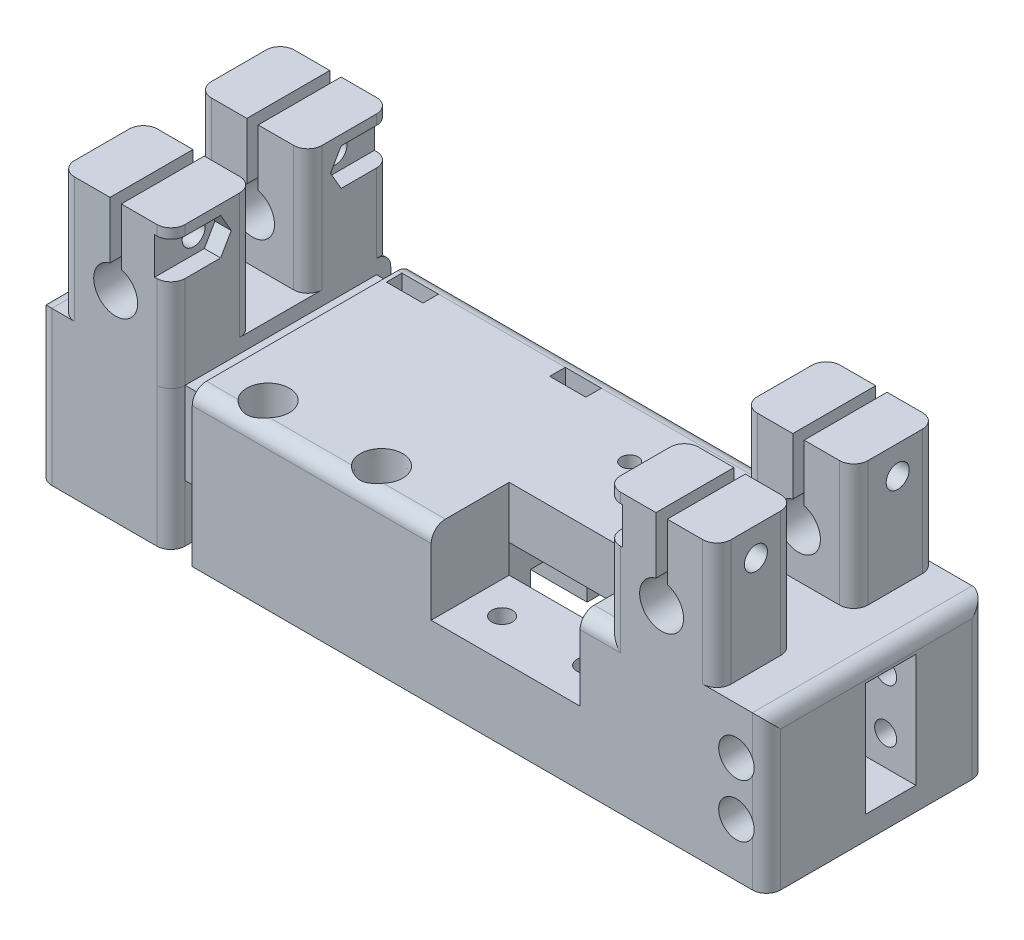
from build123d import *
from OCP.BRepFilletAPI import BRepFilletAPI_MakeChamfer

# Parameters (mm, degrees)
SKETCH1_R                      = 3.0999999999999877
SKETCH1_R_2                    = 3.099999999999995
SKETCH1_R_3                    = 3.4999999999999822
BOSS_EXTRUDE1_DEPTH            = 31
BOSS_EXTRUDE2_DEPTH            = 8
SKETCH3_R                      = 1.2000000000000004
SKETCH3_R_2                    = 1.2000000000000113
CUT_EXTRUDE1_DEPTH             = 71.57779906528764
CUT_EXTRUDE4_START             = -1.9
CUT_EXTRUDE4_DEPTH             = 1.9
CUT_EXTRUDE5_DEPTH             = 14
CUT_EXTRUDE6_REACH             = 106.86
SKETCH8_W                      = 3
SKETCH8_H                      = 17.650000000001818
CUT_EXTRUDE7_REACH             = 106.86
SKETCH9_W                      = 2.3000000000000043
SKETCH9_H                      = 17.64999999999997
CUT_EXTRUDE8_REACH             = 100.506
SKETCH10_R                     = 1.6249999999999998
CUT_EXTRUDE8_DIRECTION_2_REACH = 100.506
CUT_EXTRUDE9_REACH             = 99.066
SKETCH11_R                     = 1.6250000000000013
CUT_EXTRUDE9_DIRECTION_2_REACH = 99.066
CUT_EXTRUDE10_DEPTH            = 2.3
CUT_EXTRUDE11_DEPTH            = 2.3
HOLE2_D                        = 5.6
HOLE2_DEPTH                    = 12
HOLE2_CBORE_D                  = 6
HOLE2_CBORE_DEPTH              = 8
CUT_EXTRUDE14_DEPTH            = 20
SKETCH24_R                     = 1.2000000000000004
CUT_EXTRUDE15_DEPTH            = 10
HOLE1_D                        = 5.6
HOLE1_DEPTH                    = 12
HOLE1_CBORE_D                  = 6
HOLE1_CBORE_DEPTH              = 8
CUT_EXTRUDE17_REACH            = 76.028
CUT_EXTRUDE19_REACH            = 81.375
SKETCH32_W                     = 99.00000000000004
SKETCH32_H                     = 7.999999999998149
CUT_EXTRUDE20_DEPTH            = 75.02825455816884
CHAMFER1_SIZE                  = 8
CHAMFER1_SIZE_2                = 0.2
CHAMFER2_SIZE                  = 8
CHAMFER2_SIZE_2                = 0.2
SKETCH35_W                     = 25.700000000000017
SKETCH35_H                     = 11.699999999999998
CUT_EXTRUDE22_DEPTH            = 17.65
BOSS_EXTRUDE5_DEPTH            = 11
SKETCH49_R                     = 1.675000000000001
CUT_EXTRUDE28_DEPTH            = 5
SKETCH50_W                     = 21
SKETCH50_H                     = 8
CUT_EXTRUDE29_DEPTH            = 8.65
FILLET2_R                      = 2
FILLET1_R                      = 2
M2_5_CLEARANCE_HOLE1_D         = 2.9
CUT_EXTRUDE30_DEPTH            = 8
CUT_EXTRUDE31_DEPTH            = 2
SKETCH57_W                     = 2.999999999999993
SKETCH57_H                     = 11.650000000000034
CUT_EXTRUDE32_DEPTH            = 2
SKETCH58_W                     = 3.0000000000000036
SKETCH58_H                     = 11.650000000000034
CUT_EXTRUDE33_DEPTH            = 2
CUT_EXTRUDE35_DEPTH            = 11
SKETCH61_R                     = 2.7499999999999982
CUT_EXTRUDE36_DEPTH            = 4
FILLET3_START                  = -19
FILLET3_DEPTH                  = 33.672858748
FILLET3_START_2                = 32
FILLET3_2_DEPTH                = 6.896819666
FILLET3_START_3                = 1
FILLET3_3_DEPTH                = 2.625360835
CUT_EXTRUDE37_DEPTH            = 2.2
M2_5_CLEARANCE_HOLE2_D         = 2.9
M2_5_CLEARANCE_HOLE2_DEPTH     = 11
M2_5_CLEARANCE_HOLE2_TIP       = 0.8712478975899624
SKETCH67_R                     = 1.45
SKETCH67_R_2                   = 1.4499999999999895
SKETCH67_R_3                   = 1.449999999999989
CUT_EXTRUDE38_DEPTH            = 11
SKETCH71_W                     = 31.000000000000004
SKETCH71_H                     = 21.650000000000023
BOSS_EXTRUDE6_DEPTH            = 3.8
CUT_EXTRUDE41_START            = 102.8
CUT_EXTRUDE41_DEPTH            = 8.1
M2_5_CLEARANCE_HOLE3_D         = 3.1
SKETCH83_R                     = 2.500000000000002
SKETCH83_R_2                   = 2.5000000000000018
CUT_EXTRUDE42_DEPTH            = 10
CUT_EXTRUDE43_START            = -3
SKETCH84_R                     = 1.2000000000000004
SKETCH84_W                     = 4.249999999999993
SKETCH84_H                     = 2.000000000000007
SKETCH84_W_2                   = 4.2499999999999964
CUT_EXTRUDE43_DEPTH            = 2
FILLET5_R                      = 2


with BuildPart() as part:
    # Sketch1 → Boss-Extrude1 (new body)
    with BuildSketch(Plane.XY):
        Polygon((-43.303180334061175, 29.275360835161887), (25.696819665938843, 29.275360835161887), (55.69681966593887, 29.275360835161887), (55.696819665938875, -18.024639164838103), (-43.303180334061175, -18.024639164838117), align=None)
        with Locations((-32.30318033406116, 10.275360835161894)):
            Circle(SKETCH1_R, mode=Mode.SUBTRACT)
        with Locations((44.69681966593886, 10.275360835161894)):
            Circle(SKETCH1_R_2, mode=Mode.SUBTRACT)
        with Locations((22.696819665938847, 12.275360835161898)):
            Circle(SKETCH1_R_3, mode=Mode.SUBTRACT)
        Polygon((-22.803180334061157, 19.27536083516189), (-22.803180334061153, 3.6253608351619206), (9.196819665938847, 3.6253608351619206), (9.196819665938847, 19.27536083516189), align=None, mode=Mode.SUBTRACT)
    extrude(amount=-BOSS_EXTRUDE1_DEPTH)

    # Sketch2 → Boss-Extrude2 (add)
    with BuildSketch(Plane.XY):
        with BuildLine():
            Line((24.196819665938847, 12.275360835161898), (33.19681966593885, 12.275360835161898))
            Line((33.19681966593885, 12.275360835161898), (33.19681966593885, 3.6253608351619206))
            Line((33.19681966593885, 3.6253608351619206), (12.196819665938845, 3.6253608351619206))
            Line((12.196819665938845, 3.6253608351619206), (12.196819665938845, 12.275360835161896))
            Line((12.196819665938845, 12.275360835161896), (21.196819665938843, 12.275360835161898))
            ThreePointArc((21.196819665938843, 12.275360835161898), (22.696819665938847, 10.775360835161894), (24.196819665938847, 12.275360835161898))
        make_face()
    extrude(amount=BOSS_EXTRUDE2_DEPTH)

    # Sketch3 → Cut-Extrude1 (cut, through all)
    with BuildSketch(Plane(origin=(0, 12.275360835161898, 0), x_dir=(1, 0, 0), z_dir=(0, 1, 0))):
        with Locations(Location((28.696819665938847, -4, 0), (0, 0, 270))):
            Circle(SKETCH3_R)
        with Locations(Location((16.69681966593884, -4.000000000000002, 0), (0, 0, 270))):
            Circle(SKETCH3_R_2)
    extrude(amount=-CUT_EXTRUDE1_DEPTH, mode=Mode.SUBTRACT)

    # Sketch6 → Cut-Extrude4 (cut)
    with BuildSketch(Plane(origin=(-2.37e-15, 12.275360835161894, 0), x_dir=(1, 1.9e-16, 0), z_dir=(-1.9e-16, 1, 0)).offset(CUT_EXTRUDE4_START)):
        Polygon((14.571819665938843, -5.226869322027957), (14.571819665938843, -8), (18.821819665938843, -8), (18.821819665938843, -5.226869322027959), (18.821819665938843, -2.7731306779720506), (16.69681966593884, -1.5462613559440943), (14.571819665938843, -2.773130677972046), align=None)
        Polygon((30.821819665938854, -5.226869322027954), (30.821819665938854, -2.773130677972044), (28.696819665938843, -1.546261355944084), (26.571819665938843, -2.773130677972039), (26.571819665938843, -5.226869322027955), (26.571819665938843, -8), (30.821819665938854, -8), align=None)
    extrude(amount=-CUT_EXTRUDE4_DEPTH, mode=Mode.SUBTRACT)

    # Sketch7 → Cut-Extrude5 (cut)
    with BuildSketch(Plane.XY):
        with BuildLine():
            Line((-43.303180334061175, 22.77536083516189), (-22.503180334061174, 22.77536083516189))
            Line((-22.503180334061174, 22.77536083516189), (-22.503180334061156, 3.6253608351619206))
            Line((-22.503180334061156, 3.6253608351619206), (-24.503180334061156, 3.6253608351619206))
            Line((-24.503180334061156, 3.6253608351619206), (-24.50318033406117, 21.275360835161894))
            Line((-24.50318033406117, 21.275360835161894), (-31.503180334061174, 21.27536083516189))
            Line((-31.503180334061174, 21.27536083516189), (-31.503180334061167, 13.270356661536272))
            ThreePointArc((-31.503180334061167, 13.270356661536272), (-32.30318033406115, 7.175360835161904), (-33.103180334061165, 13.27035666153627))
            Line((-33.103180334061165, 13.27035666153627), (-33.103180334061165, 21.27536083516189))
            Line((-33.103180334061165, 21.27536083516189), (-40.103180334061165, 21.27536083516189))
            Line((-40.103180334061165, 21.27536083516189), (-40.103180334061165, 3.6253608351619198))
            Line((-40.103180334061165, 3.6253608351619198), (-43.303180334061175, 3.6253608351619198))
            Line((-43.303180334061175, 3.6253608351619198), (-43.303180334061175, 22.77536083516189))
        make_face()
        with BuildLine():
            Line((34.896819665938864, 22.775360835163738), (55.696819665938875, 22.775360835163738))
            Line((55.696819665938875, 22.775360835163738), (55.696819665938875, 3.6253608351619215))
            Line((55.696819665938875, 3.6253608351619215), (52.49681966593886, 3.6253608351619206))
            Line((52.49681966593886, 3.6253608351619206), (52.49681966593886, 21.275360835163738))
            Line((52.49681966593886, 21.275360835163738), (45.49681966593886, 21.275360835163738))
            Line((45.49681966593886, 21.275360835163738), (45.496819665938865, 13.27035666153627))
            ThreePointArc((45.496819665938865, 13.27035666153627), (44.69681966593886, 7.1753608351619), (43.89681966593886, 13.270356661536274))
            Line((43.89681966593886, 13.270356661536274), (43.89681966593886, 21.275360835163738))
            Line((43.89681966593886, 21.275360835163738), (36.89681966593886, 21.275360835163738))
            Line((36.89681966593886, 21.275360835163738), (36.89681966593886, 3.6253608351619206))
            Line((36.89681966593886, 3.6253608351619206), (34.89681966593886, 3.6253608351619198))
            Line((34.89681966593886, 3.6253608351619198), (34.896819665938864, 22.775360835163738))
        make_face()
    cut_extrude5 = extrude(amount=-CUT_EXTRUDE5_DEPTH, mode=Mode.SUBTRACT)

    # Sketch8 → Cut-Extrude6 (cut, up to next)
    with BuildSketch(Plane(origin=(52.49681966593886, 0, 0), x_dir=(0, 0, -1), z_dir=(1, 0, 0)), mode=Mode.PRIVATE) as cut_extrude6_sk1:
        with Locations((12.500000000000002, 12.45036083516283)):
            Rectangle(SKETCH8_W, SKETCH8_H)
    cut_extrude6_tool1 = extrude(cut_extrude6_sk1.sketch, amount=-CUT_EXTRUDE6_REACH, mode=Mode.PRIVATE) & part.part
    add(cut_extrude6_tool1.solids().sort_by_distance((52.49682, 12.450361, -12.5))[0], mode=Mode.SUBTRACT)

    # Sketch9 → Cut-Extrude7 (cut, up to next)
    with BuildSketch(Plane.ZY.offset(40.103180334061165), mode=Mode.PRIVATE) as cut_extrude7_sk1:
        with Locations((-12.85, 12.450360835161906)):
            Rectangle(SKETCH9_W, SKETCH9_H)
    cut_extrude7_tool1 = extrude(cut_extrude7_sk1.sketch, amount=-CUT_EXTRUDE7_REACH, mode=Mode.PRIVATE) & part.part
    add(cut_extrude7_tool1.solids().sort_by_distance((-40.10318, 12.450361, -12.85))[0], mode=Mode.SUBTRACT)

    # Sketch10 → Cut-Extrude8 (cut, up to next)
    with BuildSketch(Plane(origin=(-33.103180334061165, 0, 0), x_dir=(0, 0, -1), z_dir=(1, 0, 0)), mode=Mode.PRIVATE) as cut_extrude8_sk1:
        with Locations((5.500000000000001, 17.27285874834908)):
            Circle(SKETCH10_R)
    cut_extrude8_tool1 = extrude(cut_extrude8_sk1.sketch, amount=-CUT_EXTRUDE8_REACH, mode=Mode.PRIVATE) & part.part
    cut_extrude8 = cut_extrude8_tool1.solids().sort_by_distance((-33.10318, 17.272859, -5.5))[0]
    add(cut_extrude8, mode=Mode.SUBTRACT)

    # Sketch10 → Cut-Extrude8 direction 2 (cut, up to next)
    with BuildSketch(Plane(origin=(-33.103180334061165, 0, 0), x_dir=(0, 0, -1), z_dir=(1, 0, 0)), mode=Mode.PRIVATE) as cut_extrude8_direction_2_sk1:
        with Locations((5.500000000000001, 17.27285874834908)):
            Circle(SKETCH10_R)
    cut_extrude8_direction_2_tool1 = extrude(cut_extrude8_direction_2_sk1.sketch, amount=CUT_EXTRUDE8_DIRECTION_2_REACH, mode=Mode.PRIVATE) & part.part
    cut_extrude8_direction_2 = cut_extrude8_direction_2_tool1.solids().sort_by_distance((-33.10318, 17.272859, -5.5))[0]
    add(cut_extrude8_direction_2, mode=Mode.SUBTRACT)

    # Sketch11 → Cut-Extrude9 (cut, up to next)
    with BuildSketch(Plane(origin=(43.89681966593886, 0, 0), x_dir=(0, 0, -1), z_dir=(1, 0, 0)), mode=Mode.PRIVATE) as cut_extrude9_sk1:
        with Locations((5.5, 17.272858748350007)):
            Circle(SKETCH11_R)
    cut_extrude9_tool1 = extrude(cut_extrude9_sk1.sketch, amount=-CUT_EXTRUDE9_REACH, mode=Mode.PRIVATE) & part.part
    cut_extrude9 = cut_extrude9_tool1.solids().sort_by_distance((43.89682, 17.272859, -5.5))[0]
    add(cut_extrude9, mode=Mode.SUBTRACT)

    # Sketch11 → Cut-Extrude9 direction 2 (cut, up to next)
    with BuildSketch(Plane(origin=(43.89681966593886, 0, 0), x_dir=(0, 0, -1), z_dir=(1, 0, 0)), mode=Mode.PRIVATE) as cut_extrude9_direction_2_sk1:
        with Locations((5.5, 17.272858748350007)):
            Circle(SKETCH11_R)
    cut_extrude9_direction_2_tool1 = extrude(cut_extrude9_direction_2_sk1.sketch, amount=CUT_EXTRUDE9_DIRECTION_2_REACH, mode=Mode.PRIVATE) & part.part
    cut_extrude9_direction_2 = cut_extrude9_direction_2_tool1.solids().sort_by_distance((43.89682, 17.272859, -5.5))[0]
    add(cut_extrude9_direction_2, mode=Mode.SUBTRACT)

    # Sketch12 → Cut-Extrude10 (cut)
    with BuildSketch(Plane.ZY.offset(-36.89681966593886)):
        Polygon((-3.998889300106973, 19.872858748349078), (1e-17, 19.872858748349078), (6.5e-16, 14.672858748349078), (-3.9988893001069723, 14.672858748349077), (-7.001110699893019, 14.672858748349075), (-8.502221399786048, 17.27285874834908), (-7.001110699893025, 19.872858748349078), align=None)
    cut_extrude10 = extrude(amount=-CUT_EXTRUDE10_DEPTH, mode=Mode.SUBTRACT)

    # Sketch13 → Cut-Extrude11 (cut)
    with BuildSketch(Plane(origin=(-24.503180334061152, -1.927e-14, 0), x_dir=(0, 0, -1), z_dir=(1, 5e-17, 0))):
        Polygon((3.998889300106974, 19.87285874835002), (0, 19.87285874835002), (-6.5e-16, 14.672858748349094), (3.998889300106973, 14.672858748350016), (7.001110699893027, 14.672858748350018), (8.502221399786055, 17.272858748350018), (7.0011106998930295, 19.87285874835002), align=None)
    cut_extrude11 = extrude(amount=-CUT_EXTRUDE11_DEPTH, mode=Mode.SUBTRACT)

    # Hole2
    with Locations(Plane(origin=(2.53e-15, -18.02463916483811, 0), x_dir=(-1, -1.2e-16, 0), z_dir=(1.2e-16, -1, 0))):
        with Locations((-46.196819666, 10), (33.803180334, 10)):
            CounterBoreHole(HOLE2_D / 2, HOLE2_CBORE_D / 2, HOLE2_CBORE_DEPTH, depth=HOLE2_DEPTH)

    # Sketch23 → Cut-Extrude14 (cut)
    with BuildSketch(Plane(origin=(0, 0, -31), x_dir=(-1, 0, 0), z_dir=(0, 0, -1))):
        Polygon((-34.69681966593882, -18.024639164838117), (-10.696819665938829, -18.024639164838117), (-10.696819665938829, -3.7246391648381154), (-34.696819665938825, -3.7246391648381154), align=None)
    extrude(amount=-CUT_EXTRUDE14_DEPTH, mode=Mode.SUBTRACT)

    # Sketch24 → Cut-Extrude15 (cut)
    with BuildSketch(Plane.XZ.offset(3.7246391648381154)):
        with Locations(Location((18.196819665938833, -22, 0), (0, 0, 270))):
            Circle(SKETCH24_R)
        with Locations(Location((27.696819665938833, -22, 0), (0, 0, 270))):
            Circle(SKETCH24_R)
    extrude(amount=-CUT_EXTRUDE15_DEPTH, mode=Mode.SUBTRACT)

    # Hole1
    with Locations(Plane(origin=(0, 3.6253608351619206, 0), x_dir=(1, 0, 0), z_dir=(0, 1, 0))):
        with Locations((-14.803180334, 4), (1.196819666, 4)):
            CounterBoreHole(HOLE1_D / 2, HOLE1_CBORE_D / 2, HOLE1_CBORE_DEPTH, depth=HOLE1_DEPTH)

    # Sketch30 → Cut-Extrude17 (cut, up to next)
    with BuildSketch(Plane(origin=(0, 0, -31), x_dir=(-1, 0, 0), z_dir=(0, 0, -1)), mode=Mode.PRIVATE) as cut_extrude17_sk1:
        Polygon((-9.196819665938847, 3.6253608351619206), (22.803180334061157, 3.6253608351619198), (22.803180334061153, 29.275360835161887), (-9.196819665938847, 29.275360835161887), align=None)
    cut_extrude17_tool1 = extrude(cut_extrude17_sk1.sketch, amount=-CUT_EXTRUDE17_REACH, mode=Mode.PRIVATE) & part.part
    add(cut_extrude17_tool1.solids().sort_by_distance((-6.80318, 16.450361, -31))[0], mode=Mode.SUBTRACT)

    # Mirror1: Cut-Extrude5, Cut-Extrude8, Cut-Extrude8 direction 2, Cut-Extrude9, Cut-Extrude9 direction 2, Cut-Extrude10, Cut-Extrude11 across plane
    add(cut_extrude5.mirror(Plane(origin=(0, 0, -15.5), x_dir=(1, 0, 0), z_dir=(0, 0, -1))), mode=Mode.SUBTRACT)
    add(cut_extrude8.mirror(Plane(origin=(0, 0, -15.5), x_dir=(1, 0, 0), z_dir=(0, 0, -1))), mode=Mode.SUBTRACT)
    add(cut_extrude8_direction_2.mirror(Plane(origin=(0, 0, -15.5), x_dir=(1, 0, 0), z_dir=(0, 0, -1))), mode=Mode.SUBTRACT)
    add(cut_extrude9.mirror(Plane(origin=(0, 0, -15.5), x_dir=(1, 0, 0), z_dir=(0, 0, -1))), mode=Mode.SUBTRACT)
    add(cut_extrude9_direction_2.mirror(Plane(origin=(0, 0, -15.5), x_dir=(1, 0, 0), z_dir=(0, 0, -1))), mode=Mode.SUBTRACT)
    add(cut_extrude10.mirror(Plane(origin=(0, 0, -15.5), x_dir=(1, 0, 0), z_dir=(0, 0, -1))), mode=Mode.SUBTRACT)
    add(cut_extrude11.mirror(Plane(origin=(0, 0, -15.5), x_dir=(1, 0, 0), z_dir=(0, 0, -1))), mode=Mode.SUBTRACT)

    # Cut-Extrude19: up to this face of the body (flat: up to its plane)
    cut_extrude19_end = Plane(part.part.faces().sort_by_distance((-9.887154549, 3.625360835, -15.663977194))[0])
    # Sketch31 → Cut-Extrude19 (cut, up to the picked face)
    with BuildSketch(Plane(origin=(0, 29.275360835161887, 0), x_dir=(1, 0, 0), z_dir=(0, 1, 0)), mode=Mode.PRIVATE) as cut_extrude19_sk1:
        Polygon((-43.30318033406118, 11.7), (55.696819665938875, 11.7), (55.696819665938875, 19.30000000000004), (-43.30318033406118, 19.299999999999997), align=None)
    cut_extrude19_tool1 = split(extrude(cut_extrude19_sk1.sketch, amount=-CUT_EXTRUDE19_REACH, mode=Mode.PRIVATE), bisect_by=cut_extrude19_end, keep=Keep.BOTH, mode=Mode.PRIVATE)
    add(cut_extrude19_tool1.solids().sort_by(Axis((6.19682, 29.275361, -15.5), (0, -1, 0)))[0], mode=Mode.SUBTRACT)


with BuildPart() as cut_extrude19_piece_1:
    # of the separate pieces the step leaves, piece 1, a body of its own (cut_extrude19_pieces)
    add(part.part.solids().sort_by_distance((-40.103180334, 3.625360835, 0))[0])


with BuildPart() as cut_extrude19_piece_2:
    # of the separate pieces the step leaves, piece 2, a body of its own (cut_extrude19_pieces)
    add(part.part.solids().sort_by_distance((-43.303180334, 29.275360835, 0))[0])


with BuildPart() as cut_extrude19_piece_3:
    # of the separate pieces the step leaves, piece 3, a body of its own (cut_extrude19_pieces)
    add(part.part.solids().sort_by_distance((-22.803180334, 29.275360835, -19.3))[0])


with BuildPart() as cut_extrude20_tool:
    # Sketch32 → Cut-Extrude20 (new, through all)
    with BuildSketch(Plane(origin=(0, 0, -31), x_dir=(-1, 0, 0), z_dir=(0, 0, -1))):
        with Locations((-6.196819665938847, 25.275360835162815)):
            Rectangle(SKETCH32_W, SKETCH32_H)
    extrude(amount=-CUT_EXTRUDE20_DEPTH)


with BuildPart() as cut_extrude19_piece_1_1:
    add(cut_extrude19_piece_1.part)

    # Cut-Extrude20: cut by cut_extrude20_tool
    add(cut_extrude20_tool.part, mode=Mode.SUBTRACT)

    # Chamfer1
    chamfer1_edges_1 = [cut_extrude19_piece_1_1.edges().sort_by_distance(p)[0] for p in [
        (-1.803180334, -4.374639164838079, -4),
    ]]
    chamfer1_side_1 = [cut_extrude19_piece_1_1.faces().sort_by_distance(p)[0] for p in [
        (-1.803180334, -4.37063916483808, -4),
    ]]
    chamfer1_edges_2 = [cut_extrude19_piece_1_1.edges().sort_by_distance(p)[0] for p in [
        (-17.803180334, -4.374639164838079, -4),
    ]]
    chamfer1_side_2 = [cut_extrude19_piece_1_1.faces().sort_by_distance(p)[0] for p in [
        (-17.803180334, -4.37063916483808, -4),
    ]]
    chamfer1 = BRepFilletAPI_MakeChamfer(cut_extrude19_piece_1_1.part.solid().wrapped)
    for e in chamfer1_edges_1:
        chamfer1.Add(CHAMFER1_SIZE - 0.0001, CHAMFER1_SIZE_2 - 0.0001, e.wrapped, chamfer1_side_1[0].wrapped)
    for e in chamfer1_edges_2:
        chamfer1.Add(CHAMFER1_SIZE - 0.0001, CHAMFER1_SIZE_2 - 0.0001, e.wrapped, chamfer1_side_2[0].wrapped)
    add(Compound.cast(chamfer1.Shape()), mode=Mode.REPLACE)  # a hair under: the kernel refuses the full size

    # Chamfer2
    chamfer2_edges_1 = [cut_extrude19_piece_1_1.edges().sort_by_distance(p)[0] for p in [
        (-30.803180333999997, -10.024639164838113, -10),
    ]]
    chamfer2_side_1 = [cut_extrude19_piece_1_1.faces().sort_by_distance(p)[0] for p in [
        (-30.803180333999997, -10.028639164838113, -10),
    ]]
    chamfer2_edges_2 = [cut_extrude19_piece_1_1.edges().sort_by_distance(p)[0] for p in [
        (49.196819666, -10.024639164838103, -10),
    ]]
    chamfer2_side_2 = [cut_extrude19_piece_1_1.faces().sort_by_distance(p)[0] for p in [
        (49.196819666, -10.028639164838102, -10),
    ]]
    chamfer2 = BRepFilletAPI_MakeChamfer(cut_extrude19_piece_1_1.part.solid().wrapped)
    for e in chamfer2_edges_1:
        chamfer2.Add(CHAMFER2_SIZE - 0.0001, CHAMFER2_SIZE_2 - 0.0001, e.wrapped, chamfer2_side_1[0].wrapped)
    for e in chamfer2_edges_2:
        chamfer2.Add(CHAMFER2_SIZE - 0.0001, CHAMFER2_SIZE_2 - 0.0001, e.wrapped, chamfer2_side_2[0].wrapped)
    add(Compound.cast(chamfer2.Shape()), mode=Mode.REPLACE)  # a hair under: the kernel refuses the full size

    # Sketch35 → Cut-Extrude22 (cut)
    with BuildSketch(Plane(origin=(0, 21.275360835163738, 0), x_dir=(1, 0, 0), z_dir=(0, 1, 0))):
        with Locations((22.046819665938855, 5.849999999999999)):
            Rectangle(SKETCH35_W, SKETCH35_H)
        Polygon((34.89681966593886, 19.30000000000003), (9.196819665938847, 19.30000000000002), (9.196819665938847, 31), (34.896819665938864, 31), align=None)
    extrude(amount=-CUT_EXTRUDE22_DEPTH, mode=Mode.SUBTRACT)


with BuildPart() as cut_extrude19_piece_2_1:
    add(cut_extrude19_piece_2.part)

    # Cut-Extrude20: cut by cut_extrude20_tool
    add(cut_extrude20_tool.part, mode=Mode.SUBTRACT)


with BuildPart() as cut_extrude19_piece_3_1:
    add(cut_extrude19_piece_3.part)

    # Cut-Extrude20: cut by cut_extrude20_tool
    add(cut_extrude20_tool.part, mode=Mode.SUBTRACT)


with BuildPart() as cut_extrude22_piece_1:
    # of the separate pieces the step leaves, piece 1, a body of its own (cut_extrude22_pieces)
    add(cut_extrude19_piece_1_1.part.solids().sort_by_distance((43.196819666, -18.024539165, -10))[0])



with BuildPart() as cut_extrude22_piece_2:
    # of the separate pieces the step leaves, piece 2, a body of its own (cut_extrude22_pieces)
    add(cut_extrude19_piece_1_1.part.solids().sort_by_distance((33.196819666, 3.625360835, 8))[0])


with BuildPart() as cut_extrude22_piece_1_1:
    add(cut_extrude22_piece_1.part)

    add(cut_extrude22_piece_2.part)  # Boss-Extrude5 merges Cut-Extrude22 piece 2
    # Sketch48 → Boss-Extrude5 (add)
    with BuildSketch(Plane.XY):
        with BuildLine():
            Line((12.196819665938845, 3.6253608351619206), (33.19681966593885, 3.6253608351619206))
            Line((33.19681966593885, 3.6253608351619206), (33.19681966593885, 12.275360835161898))
            Line((33.19681966593885, 12.275360835161898), (24.196819665938847, 12.275360835161898))
            ThreePointArc((24.196819665938847, 12.275360835161898), (22.696819665938847, 10.775360835161894), (21.196819665938843, 12.275360835161898))
            Line((21.196819665938843, 12.275360835161898), (12.196819665938845, 12.275360835161898))
            Line((12.196819665938845, 12.275360835161898), (12.196819665938845, 3.6253608351619206))
        make_face()
    extrude(amount=-BOSS_EXTRUDE5_DEPTH)

    # Sketch49 → Cut-Extrude28 (cut)
    with BuildSketch(Plane(origin=(0, 12.275360835161898, 0), x_dir=(1, 0, 0), z_dir=(0, 1, 0))):
        with Locations(Location((16.696819665938843, 5.500000000000002, 0), (0, 0, 270))):
            Circle(SKETCH49_R)
        with Locations(Location((28.696819665938843, 5.500000000000002, 0), (0, 0, 270))):
            Circle(SKETCH49_R)
    extrude(amount=-CUT_EXTRUDE28_DEPTH, mode=Mode.SUBTRACT)

    # Sketch50 → Cut-Extrude29 (cut)
    with BuildSketch(Plane(origin=(0, 12.275360835161898, 0), x_dir=(1, 0, 0), z_dir=(0, 1, 0))):
        with Locations((22.696819665938847, -4)):
            Rectangle(SKETCH50_W, SKETCH50_H)
    extrude(amount=-CUT_EXTRUDE29_DEPTH, mode=Mode.SUBTRACT)

    # Fillet2
    # the kernel refuses this fillet: 2 mm, written as the material it takes off along each edge
    with BuildSketch(Plane(origin=(12.196819665938845, 12.275360835161896, 5), x_dir=(0, -1, -9e-17), z_dir=(0, 9e-17, -1))) as fillet2_piece_1:
        with BuildLine():
            CenterArc((FILLET2_R, -FILLET2_R), FILLET2_R, 90, 90)
            Line((0, -FILLET2_R), (0, 0))
            Line((0, 0), (FILLET2_R, 0))
        make_face()
    extrude(amount=21, mode=Mode.SUBTRACT)
    with BuildSketch(Plane(origin=(33.19681966593885, 12.275360835161898, -16), x_dir=(0, -1, 0), z_dir=(0, 0, 1))) as fillet2_piece_2:
        with BuildLine():
            CenterArc((FILLET2_R, -FILLET2_R), FILLET2_R, 90, 90)
            Line((0, -FILLET2_R), (0, 0))
            Line((0, 0), (FILLET2_R, 0))
        make_face()
    extrude(amount=21, mode=Mode.SUBTRACT)
    with BuildSketch(Plane(origin=(12.196819665938845, 17.275360835161898, -11), x_dir=(1, 0, 0), z_dir=(0, -1, 0))) as fillet2_piece_3:
        with BuildLine():
            CenterArc((FILLET2_R, FILLET2_R), FILLET2_R, 180, 90)
            Line((0, FILLET2_R), (0, 0))
            Line((0, 0), (FILLET2_R, 0))
        make_face()
    extrude(amount=13.649999999999977, mode=Mode.SUBTRACT)
    with BuildSketch(Plane(origin=(33.19681966593885, 3.6253608351619206, -11), x_dir=(0, 0, 1), z_dir=(0, 1, 0))) as fillet2_piece_4:
        with BuildLine():
            CenterArc((FILLET2_R, -FILLET2_R), FILLET2_R, 90, 90)
            Line((0, -FILLET2_R), (0, 0))
            Line((0, 0), (FILLET2_R, 0))
        make_face()
    extrude(amount=13.649999999999977, mode=Mode.SUBTRACT)
    with BuildSketch(Plane(origin=(34.696819665938825, -3.7246391648381154, -31), x_dir=(1, -5e-16, 0), z_dir=(-5e-16, -1, 0))) as fillet2_piece_5:
        with BuildLine():
            CenterArc((FILLET2_R, FILLET2_R), FILLET2_R, 180, 90)
            Line((0, FILLET2_R), (0, 0))
            Line((0, 0), (FILLET2_R, 0))
        make_face()
    extrude(amount=19.3, mode=Mode.SUBTRACT)
    with BuildSketch(Plane(origin=(10.696819665938829, -23.024639164838117, -31), x_dir=(-1, 0, 0), z_dir=(0, 1, 0))) as fillet2_piece_6:
        with BuildLine():
            CenterArc((FILLET2_R, FILLET2_R), FILLET2_R, 180, 90)
            Line((0, FILLET2_R), (0, 0))
            Line((0, 0), (FILLET2_R, 0))
        make_face()
    extrude(amount=19.3, mode=Mode.SUBTRACT)
    with BuildSketch(Plane(origin=(12.196819665938845, 3.6253608351619206, 0), x_dir=(0, -1, 0), z_dir=(-1, 0, 0))) as fillet2_piece_7:
        with BuildLine():
            CenterArc((FILLET2_R, -FILLET2_R), FILLET2_R, 90, 90)
            Line((0, -FILLET2_R), (0, 0))
            Line((0, 0), (FILLET2_R, 0))
        make_face()
    extrude(amount=36.7, mode=Mode.SUBTRACT)
    with BuildSketch(Plane(origin=(33.19681966593885, 17.275360835161898, 0), x_dir=(-1, 0, 0), z_dir=(0, -1, 0))) as fillet2_piece_8:
        with BuildLine():
            CenterArc((FILLET2_R, FILLET2_R), FILLET2_R, 180, 90)
            Line((0, FILLET2_R), (0, 0))
            Line((0, 0), (FILLET2_R, 0))
        make_face()
    extrude(amount=13.65, mode=Mode.SUBTRACT)
    with BuildSketch(Plane(origin=(12.196819665938845, 17.275360835161898, 0), x_dir=(1, 0, 0), z_dir=(0, -1, 0))) as fillet2_piece_9:
        with BuildLine():
            CenterArc((FILLET2_R, -FILLET2_R), FILLET2_R, 90, 90)
            Line((0, -FILLET2_R), (0, 0))
            Line((0, 0), (FILLET2_R, 0))
        make_face()
    extrude(amount=13.65, mode=Mode.SUBTRACT)
    with BuildSketch(Plane(origin=(-24.503180334061156, 3.6253608351619206, -31), x_dir=(0, -4.4e-16, 1), z_dir=(1, 0, 0))) as fillet2_piece_10:
        with BuildLine():
            CenterArc((FILLET2_R, FILLET2_R), FILLET2_R, 180, 90)
            Line((8.9e-16, FILLET2_R), (0, 0))
            Line((0, 0), (FILLET2_R, 0))
        make_face()
    extrude(amount=61.40000000000001, mode=Mode.SUBTRACT)
    with BuildSketch(Plane(origin=(17.196819665938847, 3.6253608351619206, 0), x_dir=(0, -1, 0), z_dir=(-1, 0, 0))) as fillet2_piece_11a_section:
        with BuildLine():
            CenterArc((FILLET2_R, -FILLET2_R), FILLET2_R, 90, 90)
            Line((0, -FILLET2_R), (0, 0))
            Line((0, 0), (FILLET2_R, 0))
        make_face()
    fillet2_piece_11a = extrude(amount=41.7, mode=Mode.PRIVATE)
    fillet2_piece_11a = split(fillet2_piece_11a, bisect_by=Plane(origin=(12.196819665938845, 3.6253608351619206, 0), z_dir=(1, 0, 0)), keep=Keep.TOP, mode=Mode.PRIVATE)
    with BuildSketch(Plane(origin=(12.196819665938845, 17.275360835161898, 0), x_dir=(1, 0, 0), z_dir=(0, -1, 0))) as fillet2_piece_11b_section:
        with BuildLine():
            CenterArc((FILLET2_R, -FILLET2_R), FILLET2_R, 90, 90)
            Line((0, -FILLET2_R), (0, 0))
            Line((0, 0), (FILLET2_R, 0))
        make_face()
    fillet2_piece_11b = extrude(amount=18.65, mode=Mode.PRIVATE)
    fillet2_piece_11b = split(fillet2_piece_11b, bisect_by=Plane(origin=(12.196819665938845, 3.6253608351619206, 0), z_dir=(0, -1, 0)), keep=Keep.TOP, mode=Mode.PRIVATE)
    fillet2_piece_11 = fillet2_piece_11a & fillet2_piece_11b
    add(fillet2_piece_11, mode=Mode.SUBTRACT)

    # Fillet1
    fillet1_edges = [cut_extrude22_piece_1_1.edges().sort_by_distance(p)[0] for p in [
        (36.89681966593886, 12.45036083516283, -11.000000000000002),
        (-24.50318033406117, 20.574109791755948, -31),
        (-24.503180334061078, 8.149109791755539, -31),
        (36.89681966593886, 20.574109791756406, -31),
        (36.89681966593893, 8.149109791755539, -31),
        (36.89681966593886, 12.45036083516283, -19.300000000000033),
        (36.89681966593886, 20.574109791756406, 0),
        (36.89681966593886, 9.1491097917555, 0),
        (-24.50318033406116, 12.450360835161908, -19.300000000000004),
        (-24.503180334061163, 12.450360835161906, -11.7),
        (-24.50318033406117, 20.574109791755948, 0),
        (-24.503180334061078, 8.149109791755537, 3.2e-16),
        (-40.103180334061165, 12.450360835161906, -31),
        (-40.103180334061165, 12.450360835161906, -19.299999999999997),
        (-40.103180334061165, 12.450360835161906, -11.7),
        (-40.103180334061165, 12.450360835161906, 0),
        (52.49681966593886, 12.45036083516283, -31),
        (52.49681966593886, 12.45036083516283, -19.30000000000004),
        (52.49681966593886, 12.45036083516283, -11.000000000000002),
        (52.49681966593886, 12.45036083516283, 0),
    ]]
    fillet(fillet1_edges, radius=FILLET1_R)

    # M2.5 Clearance Hole1 (through all)
    with Locations(Plane(origin=(0, 7.275360835161897, 0), x_dir=(1, 0, 0), z_dir=(0, 1, 0))):
        with Locations((16.696819666, 5.5), (28.696819666, 5.5)):
            Hole(M2_5_CLEARANCE_HOLE1_D / 2)

    # Sketch55 → Cut-Extrude30 (cut)
    with BuildSketch(Plane.XZ.offset(18.02463916483811)):
        Polygon((10.696819665938827, -15.499999999999996), (-21.503180334061156, -15.500000000000002), (-21.503180334061156, 0), (-24.503180334061156, 0), (-24.503180334061152, -15.500000000000002), (-43.303180334061175, -15.500000000000005), (-43.303180334061175, -23.500000000000007), (-24.503180334061152, -23.500000000000007), (-24.503180334061152, -31), (-21.503180334061152, -31), (-21.503180334061156, -23.500000000000007), (10.696819665938829, -23.500000000000004), align=None)
    extrude(amount=-CUT_EXTRUDE30_DEPTH, mode=Mode.SUBTRACT)

    # Sketch56 → Cut-Extrude31 (cut)
    with BuildSketch(Plane(origin=(0, 3.6253608351619206, 0), x_dir=(1, 0, 0), z_dir=(0, 1, 0))):
        Polygon((-24.503180334061156, 31), (-21.503180334061156, 31), (-21.503180334061152, 0), (-24.503180334061152, 0), align=None)
    extrude(amount=-CUT_EXTRUDE31_DEPTH, mode=Mode.SUBTRACT)

    # Sketch57 → Cut-Extrude32 (cut)
    with BuildSketch(Plane(origin=(0, 0, -31), x_dir=(-1, 0, 0), z_dir=(0, 0, -1))):
        with Locations((23.003180334061152, -4.199639164838096)):
            Rectangle(SKETCH57_W, SKETCH57_H)
    extrude(amount=-CUT_EXTRUDE32_DEPTH, mode=Mode.SUBTRACT)

    # Sketch58 → Cut-Extrude33 (cut)
    with BuildSketch(Plane.XY):
        with Locations((-23.003180334061156, -4.199639164838096)):
            Rectangle(SKETCH58_W, SKETCH58_H)
    extrude(amount=-CUT_EXTRUDE33_DEPTH, mode=Mode.SUBTRACT)

    # Sketch60 → Cut-Extrude35 (cut)
    with BuildSketch(Plane.XY):
        Polygon((33.19681966593885, -7.724639164838103), (12.196819665938843, -7.724639164838105), (12.196819665938843, 12.275360835161896), (33.19681966593885, 12.275360835161898), align=None)
    extrude(amount=-CUT_EXTRUDE35_DEPTH, mode=Mode.SUBTRACT)

    # Sketch61 → Cut-Extrude36 (cut)
    with BuildSketch(Plane.XZ.offset(18.02463916483811)):
        with Locations((16.69681966593884, -5.500000000000002)):
            Circle(SKETCH61_R)
        with Locations((28.69681966593884, -5.500000000000002)):
            Circle(SKETCH61_R)
    extrude(amount=-CUT_EXTRUDE36_DEPTH, mode=Mode.SUBTRACT)

    # Fillet3: read off the stored shape, not the designer's step
    # Fillet3 outline → Fillet3 (cut)
    with BuildSketch(Plane(origin=(0, 0, 0), x_dir=(1, 0, 0), z_dir=(0, 1, 0)).offset(FILLET3_START)):
        with BuildLine():
            Line((-24.503180334, 0), (-24.503180334, 2))
            ThreePointArc((-24.503180334, 2), (-25.088966772, 0.585786438), (-26.503180334, 0))
            Line((-26.503180334, 0), (-24.503180334, 0))
        make_face()
    extrude(amount=FILLET3_DEPTH, mode=Mode.SUBTRACT)

    # Fillet3 2 outline → Fillet3 2 (cut)
    with BuildSketch(Plane.YZ.offset(FILLET3_START_2)):
        with BuildLine():
            ThreePointArc((1.625360835, 0), (3.039574398, -0.585786437), (3.625360835, -2))
            Line((3.625360835, -2), (3.625360835, 0))
            Line((3.625360835, 0), (1.625360835, 0))
        make_face()
    extrude(amount=FILLET3_2_DEPTH, mode=Mode.SUBTRACT)

    # Fillet3 3 outline → Fillet3 3 (add)
    with BuildSketch(Plane(origin=(0, 0, 0), x_dir=(1, 0, 0), z_dir=(0, 1, 0)).offset(FILLET3_START_3)):
        with BuildLine():
            Line((36.896819665, 3), (36.896819666, 2))
            ThreePointArc((36.896819666, 2), (37.482606104, 0.585786438), (38.896819666, 0))
            Line((38.896819666, 0), (38.896819666, 3))
            Line((38.896819666, 3), (36.896819665, 3))
        make_face()
    extrude(amount=FILLET3_3_DEPTH)

    # Sketch62 → Cut-Extrude37 (cut)
    with BuildSketch(Plane(origin=(0, 0, -28.999999999999996), x_dir=(-1, 0, 0), z_dir=(0, 0, -1))):
        Polygon((-7.209819665938829, -5.052395978404569), (-7.209819665938829, 3.6253608351619206), (-2.109819665938829, 3.6253608351619206), (-2.1098196659388284, -5.052395978404567), (-2.1098196659388284, -7.996882351271662), (-4.659819665938826, -9.469125537705205), (-7.209819665938829, -7.996882351271658), align=None)
        Polygon((18.340180334061174, -9.49799305116469), (20.91518033406117, -8.011316108001404), (20.91518033406117, -5.037962221674826), (20.91518033406117, 3.6253608351619206), (15.76518033406117, 3.6253608351619206), (15.765180334061167, -5.037962221674827), (15.765180334061167, -8.011316108001402), align=None)
    extrude(amount=-CUT_EXTRUDE37_DEPTH, mode=Mode.SUBTRACT)

    # M2.5 Clearance Hole2
    with Locations(Plane(origin=(0, 0, -31), x_dir=(-1, 0, 0), z_dir=(0, 0, -1))):
        with Locations((-4.659819666, -6.524639165), (18.340180334, -6.524639165)):
            Hole(M2_5_CLEARANCE_HOLE2_D / 2, depth=M2_5_CLEARANCE_HOLE2_DEPTH)
            with Locations((0, 0, -(M2_5_CLEARANCE_HOLE2_DEPTH + M2_5_CLEARANCE_HOLE2_TIP / 2))):  # 118° drill point
                Cone(0, M2_5_CLEARANCE_HOLE2_D / 2, M2_5_CLEARANCE_HOLE2_TIP, mode=Mode.SUBTRACT)

    # Sketch67 → Cut-Extrude38 (cut)
    with BuildSketch(Plane(origin=(0, 0, -31), x_dir=(-1, 0, 0), z_dir=(0, 0, -1))):
        with BuildLine():
            ThreePointArc((-3.2098196659388325, -0.5246391648381152), (-4.659819665938833, -1.974639164838115), (-6.109819665938833, -0.5246391648381147))
            Line((-6.109819665938833, -0.5246391648381149), (-6.109819665938818, -6.524639164838114))
            ThreePointArc((-6.109819665938822, -6.5246391648381135), (-4.659819665938826, -5.074639164838118), (-3.2098196659388294, -6.524639164838114))
            Line((-3.209819665938833, -6.524639164838115), (-3.209819665938833, -0.5246391648381149))
        make_face()
        with Locations((-4.659819665938833, -0.5246391648381149)):
            Circle(SKETCH67_R)
        with Locations((-4.659819665938828, -6.524639164838114)):
            Circle(SKETCH67_R_2)
        with BuildLine():
            Line((16.890180334061185, -0.5246391648381126), (16.890180334061185, -6.524639164838113))
            ThreePointArc((16.89018033406118, -6.5246391648381135), (18.340180334061177, -5.074639164838118), (19.790180334061173, -6.524639164838114))
            Line((19.790180334061166, -6.524639164838117), (19.790180334061166, -0.5246391648381135))
            ThreePointArc((19.790180334061166, -0.524639164838116), (18.340180334061177, -1.9746391648381048), (16.89018033406119, -0.5246391648381155))
        make_face()
        with Locations((18.340180334061177, -0.5246391648381157)):
            Circle(SKETCH67_R_3)
        with Locations((18.340180334061174, -6.524639164838114)):
            Circle(SKETCH67_R_2)
    extrude(amount=-CUT_EXTRUDE38_DEPTH, mode=Mode.SUBTRACT)

    # Sketch71 → Boss-Extrude6 (add)
    with BuildSketch(Plane(origin=(55.696819665938875, 8.17e-15, 0), x_dir=(0, 0, -1), z_dir=(1, 1.5e-16, 0))):
        with Locations((15.500000000000002, -7.199639164838091)):
            Rectangle(SKETCH71_W, SKETCH71_H)
    extrude(amount=BOSS_EXTRUDE6_DEPTH)

    # Sketch80 → Cut-Extrude41 (cut)
    with BuildSketch(Plane(origin=(-43.303180334061175, 0, 0), x_dir=(0, 0, -1), z_dir=(1, 0, 0)).offset(CUT_EXTRUDE41_START)):
        Polygon((13.950000000000001, 1.2378608351619225), (21.05, 1.237860835161923), (21.05, -14.762139164838077), (13.950000000000005, -14.762139164838079), align=None)
    extrude(amount=-CUT_EXTRUDE41_DEPTH, mode=Mode.SUBTRACT)

    # M2.5 Clearance Hole3 (through all)
    with Locations(Plane.XY):
        with Locations((55.246819666, -3.012139165), (55.246819666, -10.512139165)):
            Hole(M2_5_CLEARANCE_HOLE3_D / 2)

    # Sketch83 → Cut-Extrude42 (cut)
    with BuildSketch(Plane.XY):
        with Locations((55.24681966593888, -3.0121391648380795)):
            Circle(SKETCH83_R)
        with Locations((55.24681966593888, -10.512139164838079)):
            Circle(SKETCH83_R_2)
    extrude(amount=-CUT_EXTRUDE42_DEPTH, mode=Mode.SUBTRACT)

    # Sketch84 → Cut-Extrude43 (cut)
    # profile 1 of 6: a face of its own
    with BuildSketch(Plane(origin=(0, 3.6253608351619206, 0), x_dir=(1, 0, 0), z_dir=(0, 1, 0)).offset(CUT_EXTRUDE43_START)):
        Polygon((29.821819665938833, 28.999999999999996), (25.571819665938836, 28.999999999999996), (25.571819665938836, 23.226869322027955), (27.696819665938833, 24.453738644055907), (29.821819665938833, 23.226869322027955), align=None)
    # profile 2 of 6: a face of its own
    with BuildSketch(Plane(origin=(0, 3.6253608351619206, 0), x_dir=(1, 0, 0), z_dir=(0, 1, 0)).offset(CUT_EXTRUDE43_START)):
        Polygon((25.571819665938836, 20.773130677972045), (27.69681966593883, 19.54626135594409), (29.821819665938833, 20.77313067797205), (29.821819665938833, 23.226869322027955), (27.696819665938833, 24.453738644055907), (25.571819665938836, 23.226869322027955), align=None)
        with Locations(Location((27.696819665938833, 22, 0), (0, 0, 90))):
            Circle(SKETCH84_R, mode=Mode.SUBTRACT)
    # profile 3 of 6: a face of its own
    with BuildSketch(Plane(origin=(0, 3.6253608351619206, 0), x_dir=(1, 0, 0), z_dir=(0, 1, 0)).offset(CUT_EXTRUDE43_START)):
        Polygon((16.071819665938833, 20.773130677972045), (18.196819665938836, 19.54626135594409), (20.32181966593883, 20.773130677972045), (20.32181966593883, 23.22686932202795), (18.196819665938833, 24.453738644055907), (16.071819665938833, 23.226869322027955), align=None)
        with Locations(Location((18.196819665938833, 22, 0), (0, 0, 90))):
            Circle(SKETCH84_R, mode=Mode.SUBTRACT)
    # profile 4 of 6: a face of its own
    with BuildSketch(Plane(origin=(0, 3.6253608351619206, 0), x_dir=(1, 0, 0), z_dir=(0, 1, 0)).offset(CUT_EXTRUDE43_START)):
        Polygon((16.071819665938833, 28.999999999999996), (16.071819665938833, 23.226869322027955), (18.196819665938833, 24.453738644055907), (20.32181966593883, 23.22686932202795), (20.32181966593883, 28.999999999999996), align=None)
    # profile 5 of 6: a face of its own
    with BuildSketch(Plane(origin=(0, 3.6253608351619206, 0), x_dir=(1, 0, 0), z_dir=(0, 1, 0)).offset(CUT_EXTRUDE43_START)):
        with Locations((27.696819665938836, 30)):
            Rectangle(SKETCH84_W, SKETCH84_H)
    # profile 6 of 6: a face of its own
    with BuildSketch(Plane(origin=(0, 3.6253608351619206, 0), x_dir=(1, 0, 0), z_dir=(0, 1, 0)).offset(CUT_EXTRUDE43_START)):
        with Locations((18.196819665938833, 30)):
            Rectangle(SKETCH84_W_2, SKETCH84_H)
    extrude(amount=-CUT_EXTRUDE43_DEPTH, mode=Mode.SUBTRACT)

    # Fillet5
    # the kernel refuses this fillet: 2 mm, written as the material it takes off along each edge
    with BuildSketch(Plane(origin=(-43.303180334061175, 3.6253608351619198, -36), x_dir=(1, 0, 0), z_dir=(0, 0, 1))) as fillet5_piece_1:
        with BuildLine():
            CenterArc((FILLET5_R, -FILLET5_R), FILLET5_R, 90, 89.99999999999997)
            Line((0, -FILLET5_R), (0, 0))
            Line((0, 0), (FILLET5_R, 0))
        make_face()
    extrude(amount=41, mode=Mode.SUBTRACT)
    with BuildSketch(Plane(origin=(-43.303180334061175, -23.024639164838135, -31), x_dir=(0, 0, 1), z_dir=(0, 1, 0))) as fillet5_piece_2:
        with BuildLine():
            CenterArc((FILLET5_R, FILLET5_R), FILLET5_R, 179.9999999999998, 90.00000000000023)
            Line((0, FILLET5_R), (0, 0))
            Line((0, 0), (FILLET5_R, 0))
        make_face()
    extrude(amount=31.65000000000007, mode=Mode.SUBTRACT)
    with BuildSketch(Plane(origin=(-43.303180334061175, -23.024639164838135, 0), x_dir=(1, 0, 0), z_dir=(0, 1, 0))) as fillet5_piece_3:
        with BuildLine():
            CenterArc((FILLET5_R, FILLET5_R), FILLET5_R, 180, 90)
            Line((7.11e-15, FILLET5_R), (0, 0))
            Line((0, 0), (FILLET5_R, 0))
        make_face()
    extrude(amount=31.65000000000007, mode=Mode.SUBTRACT)
    with BuildSketch(Plane(origin=(59.49681966593887, 3.62536083516193, -36), x_dir=(-1, -5.11e-15, 0), z_dir=(0, 0, 1))) as fillet5_piece_4:
        with BuildLine():
            CenterArc((FILLET5_R, FILLET5_R), FILLET5_R, 180, 89.99999999999972)
            Line((1.021e-14, FILLET5_R), (0, 0))
            Line((0, 0), (FILLET5_R, 0))
        make_face()
    extrude(amount=41, mode=Mode.SUBTRACT)
    with BuildSketch(Plane(origin=(59.49681966593887, 8.62536083516193, 0), x_dir=(-1, -1.5e-16, 0), z_dir=(1.5e-16, -1, 0))) as fillet5_piece_5:
        with BuildLine():
            CenterArc((FILLET5_R, FILLET5_R), FILLET5_R, 180, 90)
            Line((0, FILLET5_R), (0, 0))
            Line((0, 0), (FILLET5_R, 0))
        make_face()
    extrude(amount=31.65000000000002, mode=Mode.SUBTRACT)
    with BuildSketch(Plane(origin=(59.49681966593887, -23.024639164838096, -31), x_dir=(-1, -1.5e-16, 0), z_dir=(-1.5e-16, 1, 0))) as fillet5_piece_6:
        with BuildLine():
            CenterArc((FILLET5_R, FILLET5_R), FILLET5_R, 180, 90)
            Line((0, FILLET5_R), (0, 0))
            Line((0, 0), (FILLET5_R, 0))
        make_face()
    extrude(amount=31.65000000000002, mode=Mode.SUBTRACT)


solid = cut_extrude22_piece_1_1.part
